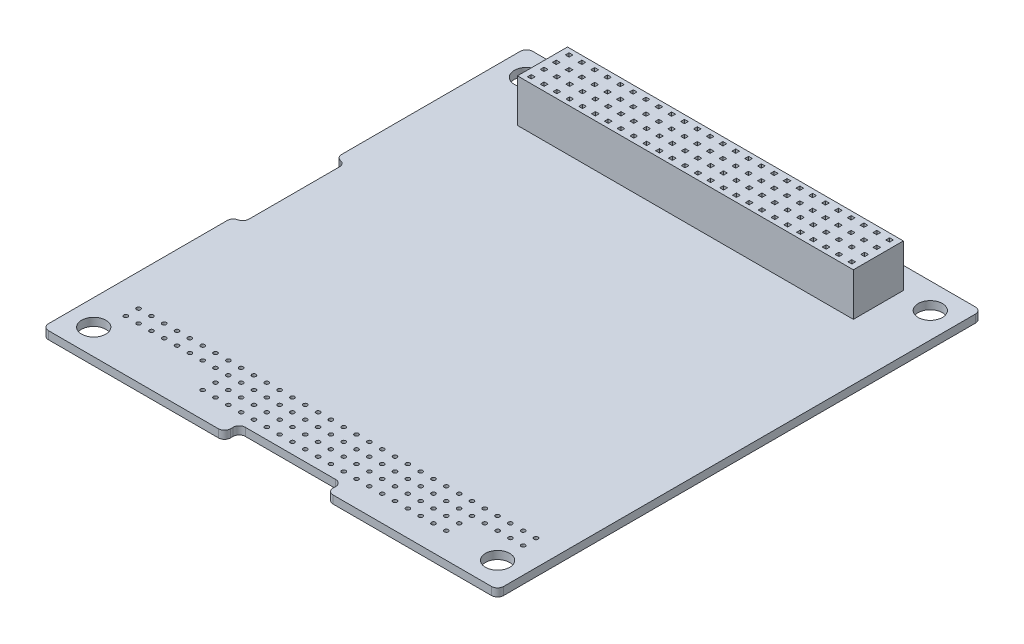
from build123d import *

# Parameters (mm, degrees)
SKETCH1_W           = 90.17
SKETCH1_H           = 95.89
BOSS_EXTRUDE1_DEPTH = 1.57
SKETCH2_W           = 20.32
SKETCH2_H           = 2.93
SKETCH2_W_2         = 1.92
SKETCH2_H_2         = 20.27
SKETCH2_H_3         = 2.92
CUT_EXTRUDE1_DEPTH  = 1.57
SKETCH3_R           = 2.4
CUT_EXTRUDE2_DEPTH  = 1.57
BOSS_EXTRUDE3_DEPTH = 8.509
FILLET7_R           = 1.2
FILLET8_R           = 1.2
FILLET9_R           = 1.2
FILLET10_R          = 1.2
FILLET11_R          = 1.2
FILLET12_R          = 1.2
FILLET13_R          = 1.2
FILLET14_R          = 1.2
FILLET17_R          = 1.2
FILLET18_R          = 1.2
FILLET19_R          = 1.2
FILLET20_R          = 1.2
FILLET21_R          = 1.2
SKETCH7_W           = 0.762
SKETCH7_H           = 0.762
CUT_EXTRUDE4_DEPTH  = 8.509
SKETCH8_W           = 0.762
SKETCH8_H           = 0.762
CUT_EXTRUDE5_DEPTH  = 8.509
SKETCH9_W           = 0.762
SKETCH9_H           = 0.762
CUT_EXTRUDE6_DEPTH  = 8.509
SKETCH10_W          = 0.762
SKETCH10_H          = 0.762
CUT_EXTRUDE7_DEPTH  = 8.509
SKETCH11_R          = 0.4
CUT_EXTRUDE8_DEPTH  = 10
SKETCH12_R          = 0.4
CUT_EXTRUDE9_DEPTH  = 10
SKETCH13_R          = 0.4
CUT_EXTRUDE10_DEPTH = 10
SKETCH14_R          = 0.4
CUT_EXTRUDE11_DEPTH = 10
SKETCH15_W          = 0.635
SKETCH15_H          = 0.635
BOSS_EXTRUDE4_DEPTH = 12.2
SKETCH16_W          = 0.635
SKETCH16_H          = 0.635
BOSS_EXTRUDE5_DEPTH = 12.2


with BuildPart() as part:
    # Sketch1 → Boss-Extrude1 (new body)
    with BuildSketch(Plane(origin=(0, 0, 0), x_dir=(1, 0, 0), z_dir=(0, 1, 0))):
        Rectangle(SKETCH1_W, SKETCH1_H)
    extrude(amount=BOSS_EXTRUDE1_DEPTH)

    # Sketch2 → Cut-Extrude1 (cut)
    with BuildSketch(Plane(origin=(0, 1.57, 0), x_dir=(1, 0, 0), z_dir=(0, 1, 0))):
        with Locations((1.145, 46.48)):
            Rectangle(SKETCH2_W, SKETCH2_H)
        with Locations((-44.125, 0)):
            Rectangle(SKETCH2_W_2, SKETCH2_H_2)
        with Locations((1.145, -46.485)):
            Rectangle(SKETCH2_W, SKETCH2_H_3)
    extrude(amount=-CUT_EXTRUDE1_DEPTH, mode=Mode.SUBTRACT)

    # Sketch3 → Cut-Extrude2 (cut)
    with BuildSketch(Plane(origin=(0, 1.57, 0), x_dir=(1, 0, 0), z_dir=(0, 1, 0))):
        with Locations((-40.005, -42.865)):
            Circle(SKETCH3_R)
        with Locations((40.005, -42.865)):
            Circle(SKETCH3_R)
        with Locations((-40.005, 42.865)):
            Circle(SKETCH3_R)
        with Locations((40.005, 42.865)):
            Circle(SKETCH3_R)
    extrude(amount=-CUT_EXTRUDE2_DEPTH, mode=Mode.SUBTRACT)

    # Sketch4 → Boss-Extrude3 (add)
    with BuildSketch(Plane(origin=(0, 1.57, 0), x_dir=(1, 0, 0), z_dir=(0, 1, 0))):
        Polygon((-32.639, 35.245), (-32.639, 33.721), (33.909, 33.721), (33.909, 43.627), (-32.639, 43.627), align=None)
    extrude(amount=BOSS_EXTRUDE3_DEPTH)

    # Fillet7
    fillet7_edges = [part.edges().sort_by_distance(p)[0] for p in [
        (-9.015, 0.785, 45.025),
    ]]
    fillet(fillet7_edges, radius=FILLET7_R)

    # Fillet8
    fillet8_edges = [part.edges().sort_by_distance(p)[0] for p in [
        (-9.015, 0.785, 47.945),
    ]]
    fillet(fillet8_edges, radius=FILLET8_R)

    # Fillet9
    fillet9_edges = [part.edges().sort_by_distance(p)[0] for p in [
        (11.305, 0.785, 47.945),
        (11.305, 0.785, 45.025),
    ]]
    fillet(fillet9_edges, radius=FILLET9_R)

    # Fillet10
    fillet10_edges = [part.edges().sort_by_distance(p)[0] for p in [
        (45.085, 0.785, 47.945),
    ]]
    fillet(fillet10_edges, radius=FILLET10_R)

    # Fillet11
    fillet11_edges = [part.edges().sort_by_distance(p)[0] for p in [
        (45.085, 0.785, -47.945),
    ]]
    fillet(fillet11_edges, radius=FILLET11_R)

    # Fillet12
    fillet12_edges = [part.edges().sort_by_distance(p)[0] for p in [
        (11.305, 0.785, -45.015),
        (11.305, 0.785, -47.945),
    ]]
    fillet(fillet12_edges, radius=FILLET12_R)

    # Fillet13
    fillet13_edges = [part.edges().sort_by_distance(p)[0] for p in [
        (-9.015, 0.785, -47.945),
        (-9.015, 0.785, -45.015),
    ]]
    fillet(fillet13_edges, radius=FILLET13_R)

    # Fillet14
    fillet14_edges = [part.edges().sort_by_distance(p)[0] for p in [
        (-45.085, 0.785, -47.945),
    ]]
    fillet(fillet14_edges, radius=FILLET14_R)

    # Fillet17
    fillet17_edges = [part.edges().sort_by_distance(p)[0] for p in [
        (-45.085, 0.785, -10.135),
    ]]
    fillet(fillet17_edges, radius=FILLET17_R)

    # Fillet18
    fillet18_edges = [part.edges().sort_by_distance(p)[0] for p in [
        (-43.165, 0.785, -10.135),
    ]]
    fillet(fillet18_edges, radius=FILLET18_R)

    # Fillet19
    fillet19_edges = [part.edges().sort_by_distance(p)[0] for p in [
        (-45.085, 0.785, 10.135),
    ]]
    fillet(fillet19_edges, radius=FILLET19_R)

    # Fillet20
    fillet20_edges = [part.edges().sort_by_distance(p)[0] for p in [
        (-43.165, 0.785, 10.135),
    ]]
    fillet(fillet20_edges, radius=FILLET20_R)

    # Fillet21
    fillet21_edges = [part.edges().sort_by_distance(p)[0] for p in [
        (-45.085, 0.785, 47.945),
    ]]
    fillet(fillet21_edges, radius=FILLET21_R)

    # Sketch7 → Cut-Extrude4 (cut)
    with BuildSketch(Plane(origin=(0, 10.079, 0), x_dir=(1, 0, 0), z_dir=(0, 1, 0))):
        with Locations((-28.575, 34.9275)):
            Rectangle(SKETCH7_W, SKETCH7_H)
        with Locations((-31.115, 34.9275)):
            Rectangle(SKETCH7_W, SKETCH7_H)
        with Locations((-26.035, 34.9275)):
            Rectangle(SKETCH7_W, SKETCH7_H)
        with Locations((-23.495, 34.9275)):
            Rectangle(SKETCH7_W, SKETCH7_H)
        with Locations((-20.955, 34.9275)):
            Rectangle(SKETCH7_W, SKETCH7_H)
        with Locations((-18.415, 34.9275)):
            Rectangle(SKETCH7_W, SKETCH7_H)
        with Locations((-15.875, 34.9275)):
            Rectangle(SKETCH7_W, SKETCH7_H)
        with Locations((-13.335, 34.9275)):
            Rectangle(SKETCH7_W, SKETCH7_H)
        with Locations((-10.795, 34.9275)):
            Rectangle(SKETCH7_W, SKETCH7_H)
        with Locations((-8.255, 34.9275)):
            Rectangle(SKETCH7_W, SKETCH7_H)
        with Locations((-5.715, 34.9275)):
            Rectangle(SKETCH7_W, SKETCH7_H)
        with Locations((-3.175, 34.9275)):
            Rectangle(SKETCH7_W, SKETCH7_H)
        with Locations((-0.635, 34.9275)):
            Rectangle(SKETCH7_W, SKETCH7_H)
        with Locations((1.905, 34.9275)):
            Rectangle(SKETCH7_W, SKETCH7_H)
        with Locations((4.445, 34.9275)):
            Rectangle(SKETCH7_W, SKETCH7_H)
        with Locations((6.985, 34.9275)):
            Rectangle(SKETCH7_W, SKETCH7_H)
        with Locations((9.525, 34.9275)):
            Rectangle(SKETCH7_W, SKETCH7_H)
        with Locations((12.065, 34.9275)):
            Rectangle(SKETCH7_W, SKETCH7_H)
        with Locations((14.605, 34.9275)):
            Rectangle(SKETCH7_W, SKETCH7_H)
        with Locations((17.145, 34.9275)):
            Rectangle(SKETCH7_W, SKETCH7_H)
        with Locations((19.685, 34.9275)):
            Rectangle(SKETCH7_W, SKETCH7_H)
        with Locations((22.225, 34.9275)):
            Rectangle(SKETCH7_W, SKETCH7_H)
        with Locations((24.765, 34.9275)):
            Rectangle(SKETCH7_W, SKETCH7_H)
        with Locations((27.305, 34.9275)):
            Rectangle(SKETCH7_W, SKETCH7_H)
        with Locations((29.845, 34.9275)):
            Rectangle(SKETCH7_W, SKETCH7_H)
        with Locations((32.385, 34.9275)):
            Rectangle(SKETCH7_W, SKETCH7_H)
    extrude(amount=-CUT_EXTRUDE4_DEPTH, mode=Mode.SUBTRACT)

    # Sketch8 → Cut-Extrude5 (cut)
    with BuildSketch(Plane(origin=(0, 10.079, 0), x_dir=(1, 0, 0), z_dir=(0, 1, 0))):
        with Locations((-28.575, 37.4675)):
            Rectangle(SKETCH8_W, SKETCH8_H)
        with Locations((-31.115, 37.4675)):
            Rectangle(SKETCH8_W, SKETCH8_H)
        with Locations((-26.035, 37.4675)):
            Rectangle(SKETCH8_W, SKETCH8_H)
        with Locations((-23.495, 37.4675)):
            Rectangle(SKETCH8_W, SKETCH8_H)
        with Locations((-20.955, 37.4675)):
            Rectangle(SKETCH8_W, SKETCH8_H)
        with Locations((-18.415, 37.4675)):
            Rectangle(SKETCH8_W, SKETCH8_H)
        with Locations((-15.875, 37.4675)):
            Rectangle(SKETCH8_W, SKETCH8_H)
        with Locations((-13.335, 37.4675)):
            Rectangle(SKETCH8_W, SKETCH8_H)
        with Locations((-10.795, 37.4675)):
            Rectangle(SKETCH8_W, SKETCH8_H)
        with Locations((-8.255, 37.4675)):
            Rectangle(SKETCH8_W, SKETCH8_H)
        with Locations((-5.715, 37.4675)):
            Rectangle(SKETCH8_W, SKETCH8_H)
        with Locations((-3.175, 37.4675)):
            Rectangle(SKETCH8_W, SKETCH8_H)
        with Locations((-0.635, 37.4675)):
            Rectangle(SKETCH8_W, SKETCH8_H)
        with Locations((1.905, 37.4675)):
            Rectangle(SKETCH8_W, SKETCH8_H)
        with Locations((4.445, 37.4675)):
            Rectangle(SKETCH8_W, SKETCH8_H)
        with Locations((6.985, 37.4675)):
            Rectangle(SKETCH8_W, SKETCH8_H)
        with Locations((9.525, 37.4675)):
            Rectangle(SKETCH8_W, SKETCH8_H)
        with Locations((12.065, 37.4675)):
            Rectangle(SKETCH8_W, SKETCH8_H)
        with Locations((14.605, 37.4675)):
            Rectangle(SKETCH8_W, SKETCH8_H)
        with Locations((17.145, 37.4675)):
            Rectangle(SKETCH8_W, SKETCH8_H)
        with Locations((19.685, 37.4675)):
            Rectangle(SKETCH8_W, SKETCH8_H)
        with Locations((22.225, 37.4675)):
            Rectangle(SKETCH8_W, SKETCH8_H)
        with Locations((24.765, 37.4675)):
            Rectangle(SKETCH8_W, SKETCH8_H)
        with Locations((27.305, 37.4675)):
            Rectangle(SKETCH8_W, SKETCH8_H)
        with Locations((29.845, 37.4675)):
            Rectangle(SKETCH8_W, SKETCH8_H)
        with Locations((32.385, 37.4675)):
            Rectangle(SKETCH8_W, SKETCH8_H)
    extrude(amount=-CUT_EXTRUDE5_DEPTH, mode=Mode.SUBTRACT)

    # Sketch9 → Cut-Extrude6 (cut)
    with BuildSketch(Plane(origin=(0, 10.079, 0), x_dir=(1, 0, 0), z_dir=(0, 1, 0))):
        with Locations((-28.575, 39.8805)):
            Rectangle(SKETCH9_W, SKETCH9_H)
        with Locations((-31.115, 39.8805)):
            Rectangle(SKETCH9_W, SKETCH9_H)
        with Locations((-26.035, 39.8805)):
            Rectangle(SKETCH9_W, SKETCH9_H)
        with Locations((-23.495, 39.8805)):
            Rectangle(SKETCH9_W, SKETCH9_H)
        with Locations((-20.955, 39.8805)):
            Rectangle(SKETCH9_W, SKETCH9_H)
        with Locations((-18.415, 39.8805)):
            Rectangle(SKETCH9_W, SKETCH9_H)
        with Locations((-15.875, 39.8805)):
            Rectangle(SKETCH9_W, SKETCH9_H)
        with Locations((-13.335, 39.8805)):
            Rectangle(SKETCH9_W, SKETCH9_H)
        with Locations((-10.795, 39.8805)):
            Rectangle(SKETCH9_W, SKETCH9_H)
        with Locations((-8.255, 39.8805)):
            Rectangle(SKETCH9_W, SKETCH9_H)
        with Locations((-5.715, 39.8805)):
            Rectangle(SKETCH9_W, SKETCH9_H)
        with Locations((-3.175, 39.8805)):
            Rectangle(SKETCH9_W, SKETCH9_H)
        with Locations((-0.635, 39.8805)):
            Rectangle(SKETCH9_W, SKETCH9_H)
        with Locations((1.905, 39.8805)):
            Rectangle(SKETCH9_W, SKETCH9_H)
        with Locations((4.445, 39.8805)):
            Rectangle(SKETCH9_W, SKETCH9_H)
        with Locations((6.985, 39.8805)):
            Rectangle(SKETCH9_W, SKETCH9_H)
        with Locations((9.525, 39.8805)):
            Rectangle(SKETCH9_W, SKETCH9_H)
        with Locations((12.065, 39.8805)):
            Rectangle(SKETCH9_W, SKETCH9_H)
        with Locations((14.605, 39.8805)):
            Rectangle(SKETCH9_W, SKETCH9_H)
        with Locations((17.145, 39.8805)):
            Rectangle(SKETCH9_W, SKETCH9_H)
        with Locations((19.685, 39.8805)):
            Rectangle(SKETCH9_W, SKETCH9_H)
        with Locations((22.225, 39.8805)):
            Rectangle(SKETCH9_W, SKETCH9_H)
        with Locations((24.765, 39.8805)):
            Rectangle(SKETCH9_W, SKETCH9_H)
        with Locations((27.305, 39.8805)):
            Rectangle(SKETCH9_W, SKETCH9_H)
        with Locations((29.845, 39.8805)):
            Rectangle(SKETCH9_W, SKETCH9_H)
        with Locations((32.385, 39.8805)):
            Rectangle(SKETCH9_W, SKETCH9_H)
    extrude(amount=-CUT_EXTRUDE6_DEPTH, mode=Mode.SUBTRACT)

    # Sketch10 → Cut-Extrude7 (cut)
    with BuildSketch(Plane(origin=(0, 10.079, 0), x_dir=(1, 0, 0), z_dir=(0, 1, 0))):
        with Locations((-28.575, 42.4205)):
            Rectangle(SKETCH10_W, SKETCH10_H)
        with Locations((-31.115, 42.4205)):
            Rectangle(SKETCH10_W, SKETCH10_H)
        with Locations((-26.035, 42.4205)):
            Rectangle(SKETCH10_W, SKETCH10_H)
        with Locations((-23.495, 42.4205)):
            Rectangle(SKETCH10_W, SKETCH10_H)
        with Locations((-20.955, 42.4205)):
            Rectangle(SKETCH10_W, SKETCH10_H)
        with Locations((-18.415, 42.4205)):
            Rectangle(SKETCH10_W, SKETCH10_H)
        with Locations((-15.875, 42.4205)):
            Rectangle(SKETCH10_W, SKETCH10_H)
        with Locations((-13.335, 42.4205)):
            Rectangle(SKETCH10_W, SKETCH10_H)
        with Locations((-10.795, 42.4205)):
            Rectangle(SKETCH10_W, SKETCH10_H)
        with Locations((-8.255, 42.4205)):
            Rectangle(SKETCH10_W, SKETCH10_H)
        with Locations((-5.715, 42.4205)):
            Rectangle(SKETCH10_W, SKETCH10_H)
        with Locations((-3.175, 42.4205)):
            Rectangle(SKETCH10_W, SKETCH10_H)
        with Locations((-0.635, 42.4205)):
            Rectangle(SKETCH10_W, SKETCH10_H)
        with Locations((1.905, 42.4205)):
            Rectangle(SKETCH10_W, SKETCH10_H)
        with Locations((4.445, 42.4205)):
            Rectangle(SKETCH10_W, SKETCH10_H)
        with Locations((6.985, 42.4205)):
            Rectangle(SKETCH10_W, SKETCH10_H)
        with Locations((9.525, 42.4205)):
            Rectangle(SKETCH10_W, SKETCH10_H)
        with Locations((12.065, 42.4205)):
            Rectangle(SKETCH10_W, SKETCH10_H)
        with Locations((14.605, 42.4205)):
            Rectangle(SKETCH10_W, SKETCH10_H)
        with Locations((17.145, 42.4205)):
            Rectangle(SKETCH10_W, SKETCH10_H)
        with Locations((19.685, 42.4205)):
            Rectangle(SKETCH10_W, SKETCH10_H)
        with Locations((22.225, 42.4205)):
            Rectangle(SKETCH10_W, SKETCH10_H)
        with Locations((24.765, 42.4205)):
            Rectangle(SKETCH10_W, SKETCH10_H)
        with Locations((27.305, 42.4205)):
            Rectangle(SKETCH10_W, SKETCH10_H)
        with Locations((29.845, 42.4205)):
            Rectangle(SKETCH10_W, SKETCH10_H)
        with Locations((32.385, 42.4205)):
            Rectangle(SKETCH10_W, SKETCH10_H)
    extrude(amount=-CUT_EXTRUDE7_DEPTH, mode=Mode.SUBTRACT)

    # Sketch11 → Cut-Extrude8 (cut)
    with BuildSketch(Plane(origin=(0, 1.57, 0), x_dir=(1, 0, 0), z_dir=(0, 1, 0))):
        with Locations((-38.735, -37.785)):
            Circle(SKETCH11_R)
        with Locations((-36.195, -37.785)):
            Circle(SKETCH11_R)
        with Locations((-33.655, -37.785)):
            Circle(SKETCH11_R)
        with Locations((-31.115, -37.785)):
            Circle(SKETCH11_R)
        with Locations((-28.575, -37.785)):
            Circle(SKETCH11_R)
        with Locations((-26.035, -37.785)):
            Circle(SKETCH11_R)
        with Locations((-23.495, -37.785)):
            Circle(SKETCH11_R)
        with Locations((-20.955, -37.785)):
            Circle(SKETCH11_R)
        with Locations((-18.415, -37.785)):
            Circle(SKETCH11_R)
        with Locations((-15.875, -37.785)):
            Circle(SKETCH11_R)
        with Locations((-13.335, -37.785)):
            Circle(SKETCH11_R)
        with Locations((-10.795, -37.785)):
            Circle(SKETCH11_R)
        with Locations((-8.255, -37.785)):
            Circle(SKETCH11_R)
        with Locations((-5.715, -37.785)):
            Circle(SKETCH11_R)
        with Locations((-3.175, -37.785)):
            Circle(SKETCH11_R)
        with Locations((-0.635, -37.785)):
            Circle(SKETCH11_R)
        with Locations((1.905, -37.785)):
            Circle(SKETCH11_R)
        with Locations((4.445, -37.785)):
            Circle(SKETCH11_R)
        with Locations((6.985, -37.785)):
            Circle(SKETCH11_R)
        with Locations((9.525, -37.785)):
            Circle(SKETCH11_R)
        with Locations((12.065, -37.785)):
            Circle(SKETCH11_R)
        with Locations((14.605, -37.785)):
            Circle(SKETCH11_R)
        with Locations((17.145, -37.785)):
            Circle(SKETCH11_R)
        with Locations((19.685, -37.785)):
            Circle(SKETCH11_R)
        with Locations((22.225, -37.785)):
            Circle(SKETCH11_R)
        with Locations((24.765, -37.785)):
            Circle(SKETCH11_R)
        with Locations((27.305, -37.785)):
            Circle(SKETCH11_R)
        with Locations((29.845, -37.785)):
            Circle(SKETCH11_R)
        with Locations((32.385, -37.785)):
            Circle(SKETCH11_R)
        with Locations((34.925, -37.785)):
            Circle(SKETCH11_R)
        with Locations((37.465, -37.785)):
            Circle(SKETCH11_R)
        with Locations((40.005, -37.785)):
            Circle(SKETCH11_R)
    extrude(amount=-CUT_EXTRUDE8_DEPTH, mode=Mode.SUBTRACT)

    # Sketch12 → Cut-Extrude9 (cut)
    with BuildSketch(Plane(origin=(0, 1.57, 0), x_dir=(1, 0, 0), z_dir=(0, 1, 0))):
        with Locations((-38.735, -35.245)):
            Circle(SKETCH12_R)
        with Locations((-36.195, -35.245)):
            Circle(SKETCH12_R)
        with Locations((-33.655, -35.245)):
            Circle(SKETCH12_R)
        with Locations((-31.115, -35.245)):
            Circle(SKETCH12_R)
        with Locations((-28.575, -35.245)):
            Circle(SKETCH12_R)
        with Locations((-26.035, -35.245)):
            Circle(SKETCH12_R)
        with Locations((-23.495, -35.245)):
            Circle(SKETCH12_R)
        with Locations((-20.955, -35.245)):
            Circle(SKETCH12_R)
        with Locations((-18.415, -35.245)):
            Circle(SKETCH12_R)
        with Locations((-15.875, -35.245)):
            Circle(SKETCH12_R)
        with Locations((-13.335, -35.245)):
            Circle(SKETCH12_R)
        with Locations((-10.795, -35.245)):
            Circle(SKETCH12_R)
        with Locations((-8.255, -35.245)):
            Circle(SKETCH12_R)
        with Locations((-5.715, -35.245)):
            Circle(SKETCH12_R)
        with Locations((-3.175, -35.245)):
            Circle(SKETCH12_R)
        with Locations((-0.635, -35.245)):
            Circle(SKETCH12_R)
        with Locations((1.905, -35.245)):
            Circle(SKETCH12_R)
        with Locations((4.445, -35.245)):
            Circle(SKETCH12_R)
        with Locations((6.985, -35.245)):
            Circle(SKETCH12_R)
        with Locations((9.525, -35.245)):
            Circle(SKETCH12_R)
        with Locations((12.065, -35.245)):
            Circle(SKETCH12_R)
        with Locations((14.605, -35.245)):
            Circle(SKETCH12_R)
        with Locations((17.145, -35.245)):
            Circle(SKETCH12_R)
        with Locations((19.685, -35.245)):
            Circle(SKETCH12_R)
        with Locations((22.225, -35.245)):
            Circle(SKETCH12_R)
        with Locations((24.765, -35.245)):
            Circle(SKETCH12_R)
        with Locations((27.305, -35.245)):
            Circle(SKETCH12_R)
        with Locations((29.845, -35.245)):
            Circle(SKETCH12_R)
        with Locations((32.385, -35.245)):
            Circle(SKETCH12_R)
        with Locations((34.925, -35.245)):
            Circle(SKETCH12_R)
        with Locations((37.465, -35.245)):
            Circle(SKETCH12_R)
        with Locations((40.005, -35.245)):
            Circle(SKETCH12_R)
    extrude(amount=-CUT_EXTRUDE9_DEPTH, mode=Mode.SUBTRACT)

    # Sketch13 → Cut-Extrude10 (cut)
    with BuildSketch(Plane(origin=(0, 1.57, 0), x_dir=(1, 0, 0), z_dir=(0, 1, 0))):
        with Locations((-18.415, -42.865)):
            Circle(SKETCH13_R)
        with Locations((-15.875, -42.865)):
            Circle(SKETCH13_R)
        with Locations((-13.335, -42.865)):
            Circle(SKETCH13_R)
        with Locations((-10.795, -42.865)):
            Circle(SKETCH13_R)
        with Locations((-8.255, -42.865)):
            Circle(SKETCH13_R)
        with Locations((-5.715, -42.865)):
            Circle(SKETCH13_R)
        with Locations((-3.175, -42.865)):
            Circle(SKETCH13_R)
        with Locations((-0.635, -42.865)):
            Circle(SKETCH13_R)
        with Locations((1.905, -42.865)):
            Circle(SKETCH13_R)
        with Locations((4.445, -42.865)):
            Circle(SKETCH13_R)
        with Locations((6.985, -42.865)):
            Circle(SKETCH13_R)
        with Locations((9.525, -42.865)):
            Circle(SKETCH13_R)
        with Locations((12.065, -42.865)):
            Circle(SKETCH13_R)
        with Locations((14.605, -42.865)):
            Circle(SKETCH13_R)
        with Locations((17.145, -42.865)):
            Circle(SKETCH13_R)
        with Locations((19.685, -42.865)):
            Circle(SKETCH13_R)
        with Locations((22.225, -42.865)):
            Circle(SKETCH13_R)
        with Locations((24.765, -42.865)):
            Circle(SKETCH13_R)
        with Locations((27.305, -42.865)):
            Circle(SKETCH13_R)
        with Locations((29.845, -42.865)):
            Circle(SKETCH13_R)
    extrude(amount=-CUT_EXTRUDE10_DEPTH, mode=Mode.SUBTRACT)

    # Sketch14 → Cut-Extrude11 (cut)
    with BuildSketch(Plane(origin=(0, 1.57, 0), x_dir=(1, 0, 0), z_dir=(0, 1, 0))):
        with Locations((-18.415, -40.325)):
            Circle(SKETCH14_R)
        with Locations((-15.875, -40.325)):
            Circle(SKETCH14_R)
        with Locations((-13.335, -40.325)):
            Circle(SKETCH14_R)
        with Locations((-10.795, -40.325)):
            Circle(SKETCH14_R)
        with Locations((-8.255, -40.325)):
            Circle(SKETCH14_R)
        with Locations((-5.715, -40.325)):
            Circle(SKETCH14_R)
        with Locations((-3.175, -40.325)):
            Circle(SKETCH14_R)
        with Locations((-0.635, -40.325)):
            Circle(SKETCH14_R)
        with Locations((1.905, -40.325)):
            Circle(SKETCH14_R)
        with Locations((4.445, -40.325)):
            Circle(SKETCH14_R)
        with Locations((6.985, -40.325)):
            Circle(SKETCH14_R)
        with Locations((9.525, -40.325)):
            Circle(SKETCH14_R)
        with Locations((12.065, -40.325)):
            Circle(SKETCH14_R)
        with Locations((14.605, -40.325)):
            Circle(SKETCH14_R)
        with Locations((17.145, -40.325)):
            Circle(SKETCH14_R)
        with Locations((19.685, -40.325)):
            Circle(SKETCH14_R)
        with Locations((22.225, -40.325)):
            Circle(SKETCH14_R)
        with Locations((24.765, -40.325)):
            Circle(SKETCH14_R)
        with Locations((27.305, -40.325)):
            Circle(SKETCH14_R)
        with Locations((29.845, -40.325)):
            Circle(SKETCH14_R)
    extrude(amount=-CUT_EXTRUDE11_DEPTH, mode=Mode.SUBTRACT)

    # Sketch15 → Boss-Extrude4 (add)
    with BuildSketch(Plane.XZ):
        with Locations((-28.575, -42.4205)):
            Rectangle(SKETCH15_W, SKETCH15_H)
        with Locations((-31.115, -42.4205)):
            Rectangle(SKETCH15_W, SKETCH15_H)
        with Locations((-26.035, -42.4205)):
            Rectangle(SKETCH15_W, SKETCH15_H)
        with Locations((-23.495, -42.4205)):
            Rectangle(SKETCH15_W, SKETCH15_H)
        with Locations((-20.955, -42.4205)):
            Rectangle(SKETCH15_W, SKETCH15_H)
        with Locations((-18.415, -42.4205)):
            Rectangle(SKETCH15_W, SKETCH15_H)
        with Locations((-15.875, -42.4205)):
            Rectangle(SKETCH15_W, SKETCH15_H)
        with Locations((-13.335, -42.4205)):
            Rectangle(SKETCH15_W, SKETCH15_H)
        with Locations((-10.795, -42.4205)):
            Rectangle(SKETCH15_W, SKETCH15_H)
        with Locations((-8.255, -42.4205)):
            Rectangle(SKETCH15_W, SKETCH15_H)
        with Locations((-5.715, -42.4205)):
            Rectangle(SKETCH15_W, SKETCH15_H)
        with Locations((-3.175, -42.4205)):
            Rectangle(SKETCH15_W, SKETCH15_H)
        with Locations((-0.635, -42.4205)):
            Rectangle(SKETCH15_W, SKETCH15_H)
        with Locations((1.905, -42.4205)):
            Rectangle(SKETCH15_W, SKETCH15_H)
        with Locations((4.445, -42.4205)):
            Rectangle(SKETCH15_W, SKETCH15_H)
        with Locations((6.985, -42.4205)):
            Rectangle(SKETCH15_W, SKETCH15_H)
        with Locations((9.525, -42.4205)):
            Rectangle(SKETCH15_W, SKETCH15_H)
        with Locations((12.065, -42.4205)):
            Rectangle(SKETCH15_W, SKETCH15_H)
        with Locations((14.605, -42.4205)):
            Rectangle(SKETCH15_W, SKETCH15_H)
        with Locations((17.145, -42.4205)):
            Rectangle(SKETCH15_W, SKETCH15_H)
        with Locations((19.685, -42.4205)):
            Rectangle(SKETCH15_W, SKETCH15_H)
        with Locations((22.225, -42.4205)):
            Rectangle(SKETCH15_W, SKETCH15_H)
        with Locations((24.765, -42.4205)):
            Rectangle(SKETCH15_W, SKETCH15_H)
        with Locations((27.305, -42.4205)):
            Rectangle(SKETCH15_W, SKETCH15_H)
        with Locations((29.845, -42.4205)):
            Rectangle(SKETCH15_W, SKETCH15_H)
        with Locations((32.385, -42.4205)):
            Rectangle(SKETCH15_W, SKETCH15_H)
    extrude(amount=BOSS_EXTRUDE4_DEPTH)

    # Sketch16 → Boss-Extrude5 (add)
    with BuildSketch(Plane.XZ):
        with Locations((-31.115, -39.8805)):
            Rectangle(SKETCH16_W, SKETCH16_H)
        with Locations((-31.115, -37.3405)):
            Rectangle(SKETCH16_W, SKETCH16_H)
        with Locations((-28.575, -39.8805)):
            Rectangle(SKETCH16_W, SKETCH16_H)
        with Locations((-31.115, -34.8005)):
            Rectangle(SKETCH16_W, SKETCH16_H)
        with Locations((-28.575, -37.3405)):
            Rectangle(SKETCH16_W, SKETCH16_H)
        with Locations((-28.575, -34.8005)):
            Rectangle(SKETCH16_W, SKETCH16_H)
        with Locations((-26.035, -39.8805)):
            Rectangle(SKETCH16_W, SKETCH16_H)
        with Locations((-26.035, -37.3405)):
            Rectangle(SKETCH16_W, SKETCH16_H)
        with Locations((-26.035, -34.8005)):
            Rectangle(SKETCH16_W, SKETCH16_H)
        with Locations((-23.495, -39.8805)):
            Rectangle(SKETCH16_W, SKETCH16_H)
        with Locations((-23.495, -37.3405)):
            Rectangle(SKETCH16_W, SKETCH16_H)
        with Locations((-23.495, -34.8005)):
            Rectangle(SKETCH16_W, SKETCH16_H)
        with Locations((-20.955, -39.8805)):
            Rectangle(SKETCH16_W, SKETCH16_H)
        with Locations((-20.955, -37.3405)):
            Rectangle(SKETCH16_W, SKETCH16_H)
        with Locations((-20.955, -34.8005)):
            Rectangle(SKETCH16_W, SKETCH16_H)
        with Locations((-18.415, -39.8805)):
            Rectangle(SKETCH16_W, SKETCH16_H)
        with Locations((-18.415, -37.3405)):
            Rectangle(SKETCH16_W, SKETCH16_H)
        with Locations((-18.415, -34.8005)):
            Rectangle(SKETCH16_W, SKETCH16_H)
        with Locations((-15.875, -39.8805)):
            Rectangle(SKETCH16_W, SKETCH16_H)
        with Locations((-15.875, -37.3405)):
            Rectangle(SKETCH16_W, SKETCH16_H)
        with Locations((-15.875, -34.8005)):
            Rectangle(SKETCH16_W, SKETCH16_H)
        with Locations((-13.335, -39.8805)):
            Rectangle(SKETCH16_W, SKETCH16_H)
        with Locations((-13.335, -37.3405)):
            Rectangle(SKETCH16_W, SKETCH16_H)
        with Locations((-13.335, -34.8005)):
            Rectangle(SKETCH16_W, SKETCH16_H)
        with Locations((-10.795, -39.8805)):
            Rectangle(SKETCH16_W, SKETCH16_H)
        with Locations((-10.795, -37.3405)):
            Rectangle(SKETCH16_W, SKETCH16_H)
        with Locations((-10.795, -34.8005)):
            Rectangle(SKETCH16_W, SKETCH16_H)
        with Locations((-8.255, -39.8805)):
            Rectangle(SKETCH16_W, SKETCH16_H)
        with Locations((-8.255, -37.3405)):
            Rectangle(SKETCH16_W, SKETCH16_H)
        with Locations((-8.255, -34.8005)):
            Rectangle(SKETCH16_W, SKETCH16_H)
        with Locations((-5.715, -39.8805)):
            Rectangle(SKETCH16_W, SKETCH16_H)
        with Locations((-5.715, -37.3405)):
            Rectangle(SKETCH16_W, SKETCH16_H)
        with Locations((-5.715, -34.8005)):
            Rectangle(SKETCH16_W, SKETCH16_H)
        with Locations((-3.175, -39.8805)):
            Rectangle(SKETCH16_W, SKETCH16_H)
        with Locations((-3.175, -37.3405)):
            Rectangle(SKETCH16_W, SKETCH16_H)
        with Locations((-3.175, -34.8005)):
            Rectangle(SKETCH16_W, SKETCH16_H)
        with Locations((-0.635, -39.8805)):
            Rectangle(SKETCH16_W, SKETCH16_H)
        with Locations((-0.635, -37.3405)):
            Rectangle(SKETCH16_W, SKETCH16_H)
        with Locations((-0.635, -34.8005)):
            Rectangle(SKETCH16_W, SKETCH16_H)
        with Locations((1.905, -39.8805)):
            Rectangle(SKETCH16_W, SKETCH16_H)
        with Locations((1.905, -37.3405)):
            Rectangle(SKETCH16_W, SKETCH16_H)
        with Locations((1.905, -34.8005)):
            Rectangle(SKETCH16_W, SKETCH16_H)
        with Locations((4.445, -39.8805)):
            Rectangle(SKETCH16_W, SKETCH16_H)
        with Locations((4.445, -37.3405)):
            Rectangle(SKETCH16_W, SKETCH16_H)
        with Locations((4.445, -34.8005)):
            Rectangle(SKETCH16_W, SKETCH16_H)
        with Locations((6.985, -39.8805)):
            Rectangle(SKETCH16_W, SKETCH16_H)
        with Locations((6.985, -37.3405)):
            Rectangle(SKETCH16_W, SKETCH16_H)
        with Locations((6.985, -34.8005)):
            Rectangle(SKETCH16_W, SKETCH16_H)
        with Locations((9.525, -39.8805)):
            Rectangle(SKETCH16_W, SKETCH16_H)
        with Locations((9.525, -37.3405)):
            Rectangle(SKETCH16_W, SKETCH16_H)
        with Locations((9.525, -34.8005)):
            Rectangle(SKETCH16_W, SKETCH16_H)
        with Locations((12.065, -39.8805)):
            Rectangle(SKETCH16_W, SKETCH16_H)
        with Locations((12.065, -37.3405)):
            Rectangle(SKETCH16_W, SKETCH16_H)
        with Locations((12.065, -34.8005)):
            Rectangle(SKETCH16_W, SKETCH16_H)
        with Locations((14.605, -39.8805)):
            Rectangle(SKETCH16_W, SKETCH16_H)
        with Locations((14.605, -37.3405)):
            Rectangle(SKETCH16_W, SKETCH16_H)
        with Locations((14.605, -34.8005)):
            Rectangle(SKETCH16_W, SKETCH16_H)
        with Locations((17.145, -39.8805)):
            Rectangle(SKETCH16_W, SKETCH16_H)
        with Locations((17.145, -37.3405)):
            Rectangle(SKETCH16_W, SKETCH16_H)
        with Locations((17.145, -34.8005)):
            Rectangle(SKETCH16_W, SKETCH16_H)
        with Locations((19.685, -39.8805)):
            Rectangle(SKETCH16_W, SKETCH16_H)
        with Locations((19.685, -37.3405)):
            Rectangle(SKETCH16_W, SKETCH16_H)
        with Locations((19.685, -34.8005)):
            Rectangle(SKETCH16_W, SKETCH16_H)
        with Locations((22.225, -39.8805)):
            Rectangle(SKETCH16_W, SKETCH16_H)
        with Locations((22.225, -37.3405)):
            Rectangle(SKETCH16_W, SKETCH16_H)
        with Locations((22.225, -34.8005)):
            Rectangle(SKETCH16_W, SKETCH16_H)
        with Locations((24.765, -39.8805)):
            Rectangle(SKETCH16_W, SKETCH16_H)
        with Locations((24.765, -37.3405)):
            Rectangle(SKETCH16_W, SKETCH16_H)
        with Locations((24.765, -34.8005)):
            Rectangle(SKETCH16_W, SKETCH16_H)
        with Locations((27.305, -39.8805)):
            Rectangle(SKETCH16_W, SKETCH16_H)
        with Locations((27.305, -37.3405)):
            Rectangle(SKETCH16_W, SKETCH16_H)
        with Locations((27.305, -34.8005)):
            Rectangle(SKETCH16_W, SKETCH16_H)
        with Locations((29.845, -39.8805)):
            Rectangle(SKETCH16_W, SKETCH16_H)
        with Locations((29.845, -37.3405)):
            Rectangle(SKETCH16_W, SKETCH16_H)
        with Locations((29.845, -34.8005)):
            Rectangle(SKETCH16_W, SKETCH16_H)
        with Locations((32.385, -39.8805)):
            Rectangle(SKETCH16_W, SKETCH16_H)
        with Locations((32.385, -37.3405)):
            Rectangle(SKETCH16_W, SKETCH16_H)
        with Locations((32.385, -34.8005)):
            Rectangle(SKETCH16_W, SKETCH16_H)
    extrude(amount=BOSS_EXTRUDE5_DEPTH)


solid = part.part
